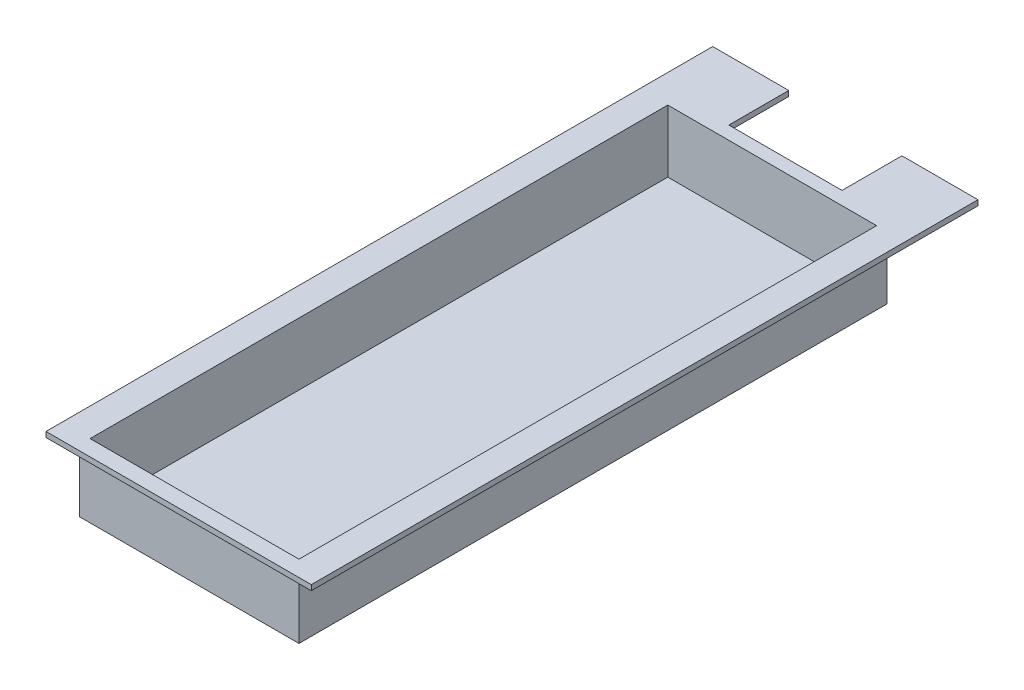
from build123d import *

# Parameters (mm, degrees)
BASE_FLANGE1_DEPTH  = 3
BOSS_EXTRUDE1_DEPTH = 35.4
BOSS_EXTRUDE2_DEPTH = 3


# Sheet-metal steps are written as plain solids
with BuildPart() as part:
    # Sketch1 → Base-Flange1 (new body)
    with BuildSketch(Plane(origin=(0, 0, 0), x_dir=(1, 0, 0), z_dir=(0, 1, 0))):
        Polygon((63.869646018, 121.746556797), (63.869646018, -211.873486949), (188.329646018, -211.873486949), (188.329646018, 121.746556797), (164.199646018, 121.746556797), (87.999646018, 121.746556797), align=None)
    extrude(amount=-BASE_FLANGE1_DEPTH)

    # Sketch75 → Boss-Extrude1 (add)
    with BuildSketch(Plane(origin=(0, 0, 0), x_dir=(1, 0, 0), z_dir=(0, 1, 0))):
        Polygon((188.329646018, -193.287020835), (188.329646018, 121.746556797), (185.329646018, 121.746556797), (164.199646018, 121.746556797), (87.999646018, 121.746556797), (63.869646018, 121.746556797), (63.869646018, -211.873486949), (66.869646018, -211.873486949), (188.329646018, -211.873486949), align=None)
        Polygon((167.199646018, 118.746556797), (185.329646018, 118.746556797), (185.329646018, -208.873486949), (66.869646018, -208.873486949), (66.869646018, 118.746556797), (84.999646018, 118.746556797), (87.999646018, 118.746556797), (164.199646018, 118.746556797), align=None, mode=Mode.SUBTRACT)
    extrude(amount=BOSS_EXTRUDE1_DEPTH)

    # Sketch76 → Boss-Extrude2 (add)
    with BuildSketch(Plane(origin=(0, 35.4, 0), x_dir=(1, 0, 0), z_dir=(0, 1, 0))):
        Polygon((188.329646018, 160.232979165), (168.60717256, 160.232979165), (158.199646018, 160.232979165), (158.199646018, 126.246556797), (93.999646018, 126.246556797), (93.999646018, 154.232979165), (93.999646018, 160.232979165), (61.173757876, 160.232979165), (50.869646018, 160.232979165), (50.869646018, -212.840780944), (50.869646018, -217.873486949), (190.329646018, -217.873486949), (201.329646018, -217.873486949), (201.329646018, 160.232979165), align=None)
        Polygon((63.869646018, -211.873486949), (63.869646018, 121.746556797), (87.999646018, 121.746556797), (142.998933393, 121.746556797), (164.199646018, 121.746556797), (188.329646018, 121.746556797), (188.329646018, -211.873486949), align=None, mode=Mode.SUBTRACT)
    extrude(amount=-BOSS_EXTRUDE2_DEPTH)


solid = part.part
